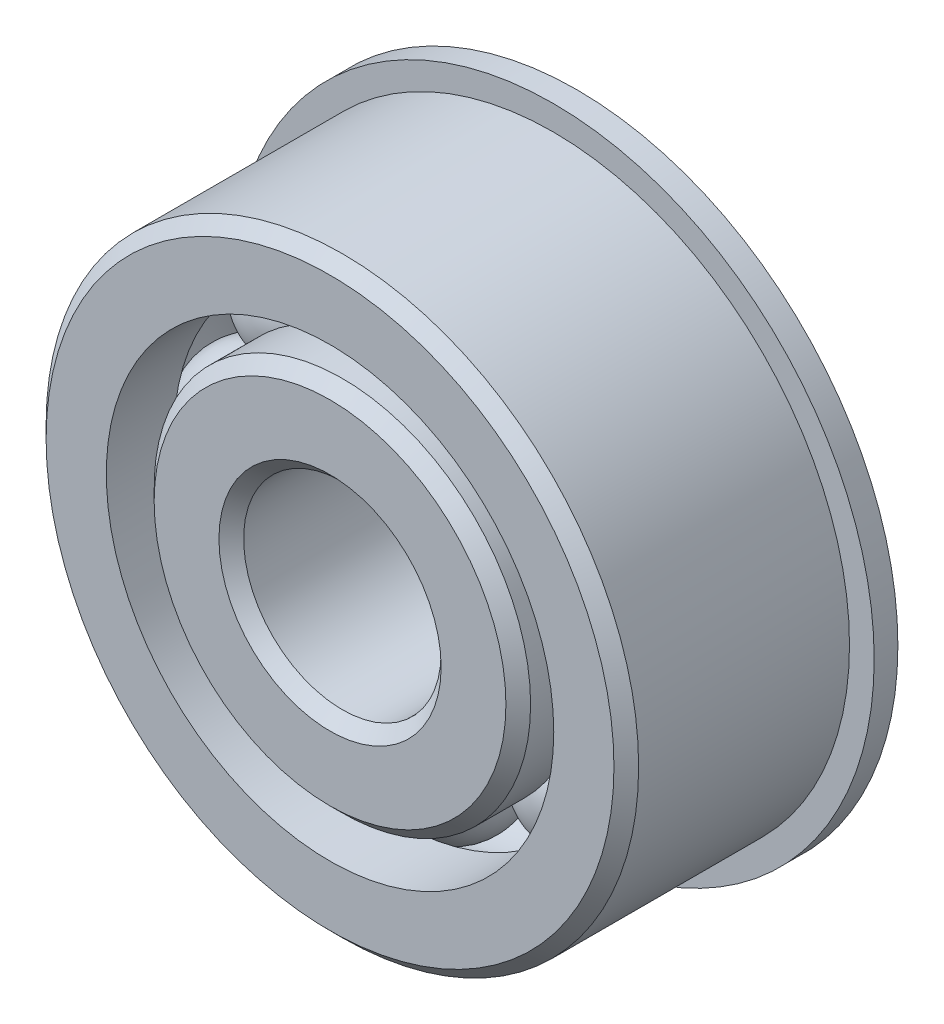
from build123d import *

# Parameters (mm, degrees)
SKETCH6_W         = 1.524
SKETCH6_H         = 6.251575
CIRPATTERN1_COUNT = 8


with BuildPart() as part:
    # Sketch1 → Revolve1 (revolve)
    with BuildSketch(Plane(origin=(0, 0, 0), x_dir=(0, 0, -1), z_dir=(1, 0, 0))):
        with BuildLine():
            Line((7.14375, 19.05), (-7.14375, 19.05))
            Line((-7.14375, 19.05), (-7.9375, 18.25625))
            Line((-7.9375, 18.25625), (-7.9375, 14.385925))
            Line((-7.9375, 14.385925), (-3.592858675, 14.385925))
            ThreePointArc((-3.592858675, 14.385925), (0, 16.66875), (3.592858675, 14.385925))
            Line((3.592858675, 14.385925), (7.9375, 14.385925))
            Line((7.9375, 14.385925), (7.9375, 18.25625))
            Line((7.9375, 18.25625), (7.14375, 19.05))
        make_face()
    revolve(axis=Axis((0, 0, 7.9375), (0, 0, -1)))

    # Sketch6 → Revolve6 (revolve)
    with BuildSketch(Plane(origin=(0, 0, 0), x_dir=(0, 0, -1), z_dir=(1, 0, 0))):
        with Locations((7.1755, 17.5117125)):
            Rectangle(SKETCH6_W, SKETCH6_H)
    revolve(axis=Axis((0, 0, -7.9375), (0, 0, 1)))


with BuildPart() as body_2:
    # Sketch3 → Revolve3 (revolve)
    with BuildSketch(Plane(origin=(0, 0, 0), x_dir=(0, 0, -1), z_dir=(1, 0, 0))):
        with BuildLine():
            Line((-7.9375, 7.14375), (-7.9375, 11.30935))
            Line((-7.9375, 11.30935), (-7.14375, 12.1031))
            Line((-7.14375, 12.1031), (-3.923606371, 12.1031))
            ThreePointArc((-3.923606371, 12.1031), (0, 8.73125), (3.923606371, 12.1031))
            Line((3.923606371, 12.1031), (8.74395, 12.1031))
            Line((8.74395, 12.1031), (9.5377, 11.30935))
            Line((9.5377, 11.30935), (9.5377, 7.14375))
            Line((9.5377, 7.14375), (8.74395, 6.35))
            Line((8.74395, 6.35), (-7.14375, 6.35))
            Line((-7.14375, 6.35), (-7.9375, 7.14375))
        make_face()
    revolve(axis=Axis((0, 0, 7.9375), (0, 0, -1)))


with BuildPart() as body_3:
    # Sketch4 → Revolve4 (revolve)
    with BuildSketch(Plane(origin=(0, 0, 0), x_dir=(0, 0, -1), z_dir=(1, 0, 0))):
        with BuildLine():
            Line((-3.96875, 12.7), (3.96875, 12.7))
            ThreePointArc((3.96875, 12.7), (0, 16.66875), (-3.96875, 12.7))
        make_face()
    revolve(axis=Axis((0, 12.7, 3.96875), (0, 0, -1)))


with BuildPart() as cirpattern1_1:
    # CirPattern1: pattern copy
    add(body_3.part.rotate(Axis((0, 0, -7.9375), (0, 0, 1)), 1 * 360 / CIRPATTERN1_COUNT))


with BuildPart() as cirpattern1_2:
    # CirPattern1: pattern copy
    add(body_3.part.rotate(Axis((0, 0, -7.9375), (0, 0, 1)), 2 * 360 / CIRPATTERN1_COUNT))


with BuildPart() as cirpattern1_3:
    # CirPattern1: pattern copy
    add(body_3.part.rotate(Axis((0, 0, -7.9375), (0, 0, 1)), 3 * 360 / CIRPATTERN1_COUNT))


with BuildPart() as cirpattern1_4:
    # CirPattern1: pattern copy
    add(body_3.part.rotate(Axis((0, 0, -7.9375), (0, 0, 1)), 4 * 360 / CIRPATTERN1_COUNT))


with BuildPart() as cirpattern1_5:
    # CirPattern1: pattern copy
    add(body_3.part.rotate(Axis((0, 0, -7.9375), (0, 0, 1)), 5 * 360 / CIRPATTERN1_COUNT))


with BuildPart() as cirpattern1_6:
    # CirPattern1: pattern copy
    add(body_3.part.rotate(Axis((0, 0, -7.9375), (0, 0, 1)), 6 * 360 / CIRPATTERN1_COUNT))


with BuildPart() as cirpattern1_7:
    # CirPattern1: pattern copy
    add(body_3.part.rotate(Axis((0, 0, -7.9375), (0, 0, 1)), 7 * 360 / CIRPATTERN1_COUNT))


solid = Compound([part.part, body_2.part, body_3.part, cirpattern1_1.part, cirpattern1_2.part, cirpattern1_3.part, cirpattern1_4.part, cirpattern1_5.part, cirpattern1_6.part, cirpattern1_7.part])
